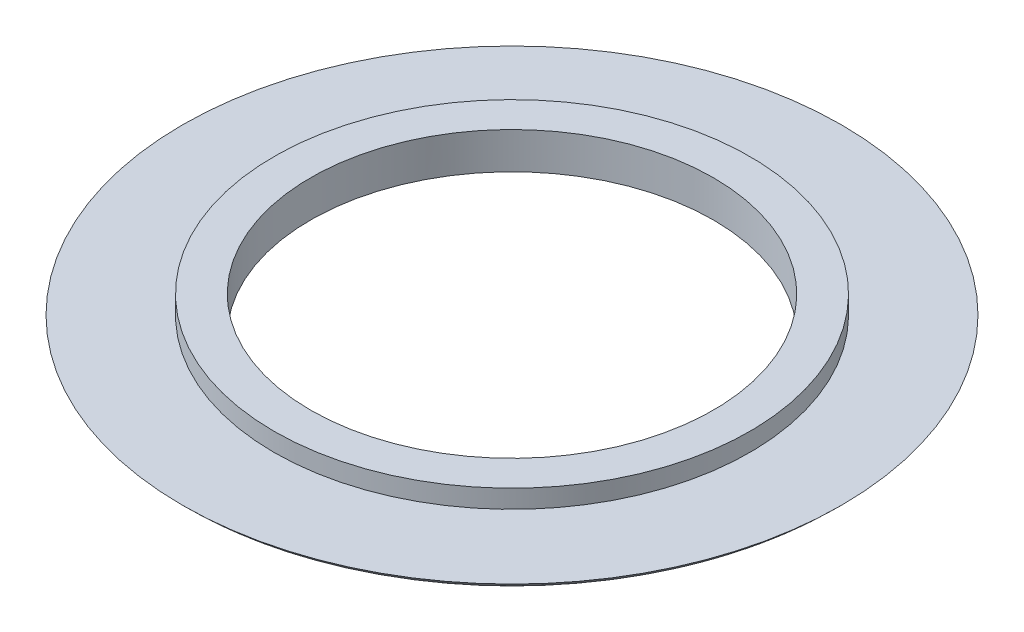
from build123d import *
from build123d.topology import SkipClean

# Parameters (mm, degrees)
SKETCH_1_R      = 13
SKETCH_1_R_2    = 11
EXTRUDE_1_DEPTH = 1
EXTRUDE_START   = 1
SKETCH_2_R      = 18
SKETCH_2_R_2    = 11
EXTRUDE_2_DEPTH = 1
FILLET_1_R      = 3


with BuildPart() as part:
    # Эскиз1 → Бобышка-Вытянуть1 (new body)
    with BuildSketch(Plane(origin=(0, 0, 0), x_dir=(1, 0, 0), z_dir=(0, 1, 0))):
        with Locations(Location((0, 0, 0), (0, 0, 270))):
            Circle(SKETCH_1_R)
        with Locations(Location((0, 0, 0), (0, 0, 270))):
            Circle(SKETCH_1_R_2, mode=Mode.SUBTRACT)
    extrude(amount=EXTRUDE_1_DEPTH)

    # Эскиз2 → Бобышка-Вытянуть2 (add)
    with SkipClean():  # the faces are left unmerged after this step: merging them gives an invalid solid
        with BuildSketch(Plane.XZ.offset(EXTRUDE_START)):
            with Locations(Location((0, 0, 0), (0, 0, 270))):
                Circle(SKETCH_2_R)
            with Locations(Location((0, 0, 0), (0, 0, 270))):
                Circle(SKETCH_2_R_2, mode=Mode.SUBTRACT)
        extrude(amount=-EXTRUDE_2_DEPTH)

    # Скругление1
    # the kernel refuses this fillet: 3 mm, written as the material it takes off along each edge
    with BuildSketch(Plane(origin=(0, -1, 0), x_dir=(0, 0, -1), z_dir=(-1, 0, 0))) as fillet_1_piece_1:
        with BuildLine():
            CenterArc((15.763932023, -3), FILLET_1_R, 41.810314896, 48.189685104)
            Line((15.763932023, 0), (15.763932023, 0.06))
            Line((15.763932023, 0.06), (18, 0.06))
            Line((18, 0.06), (18.06, 0))
            ThreePointArc((18.06, 0), (18.06, -0.5), (18.04472136, -0.96))
            Line((18.04472136, -0.96), (18, -1))
        make_face()
    revolve(axis=Axis((0, -1, 0), (0, -1, 0)), mode=Mode.SUBTRACT)


solid = part.part
